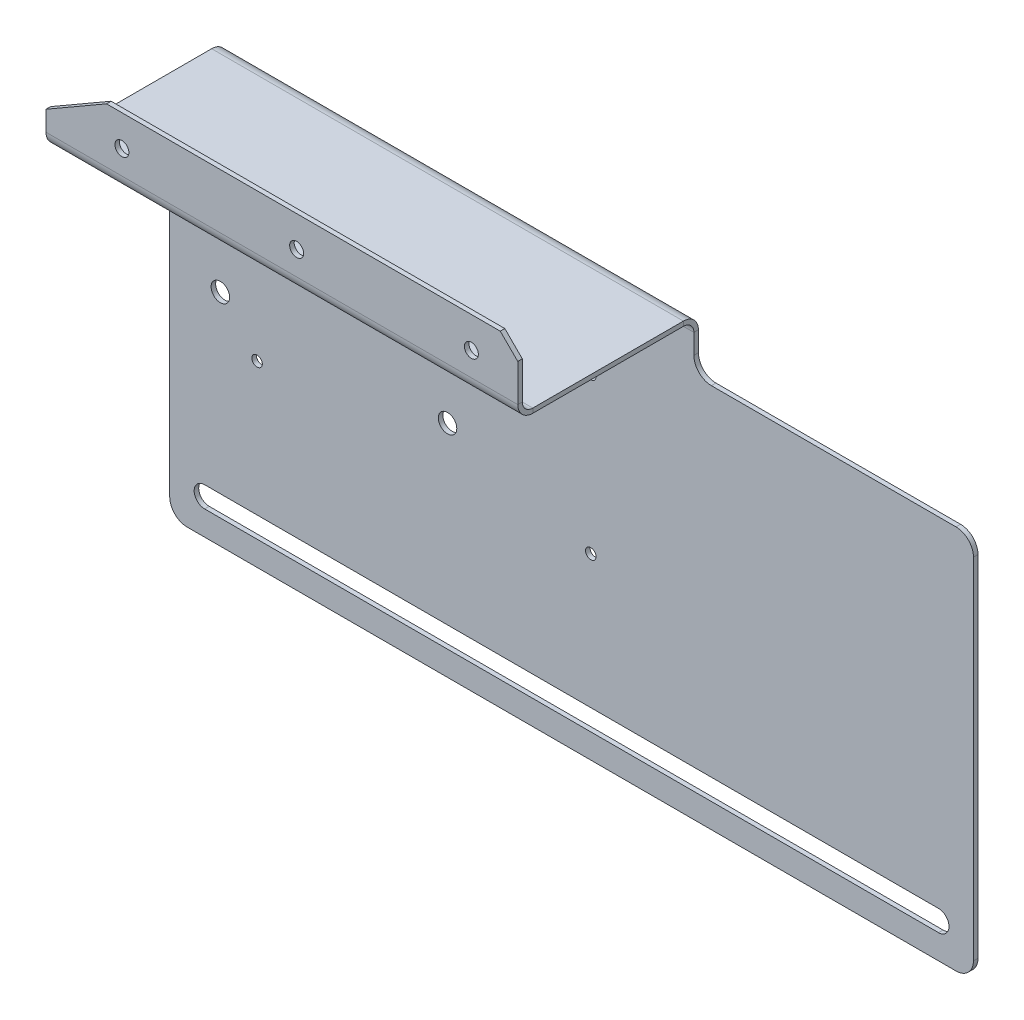
from build123d import *

# Parameters (mm, degrees)
SKETCH1_W                    = 230
SKETCH1_H                    = 125.055
BASE_FLANGE1_DEPTH           = 1.3
SKETCH12_W                   = 80
SKETCH12_H                   = 15
SKETCH12_W_2                 = 15
CUT_EXTRUDE1_DEPTH           = 131.905990147
EDGE_FLANGE1_STRIP_W         = 11.2
EDGE_FLANGE1_STRIP_H         = 1.3
EDGE_FLANGE1_STRIP_CUT_DEPTH = 135
EDGE_FLANGE1_DEPTH           = 135
EDGE_FLANGE2_DEPTH           = 135
CHAMFER1_SIZE                = 10
CHAMFER1_SIZE2               = 17.320508076
CHAMFER3_SIZE                = 5
FILLET1_R                    = 5
CUT_EXTRUDE3_DEPTH           = 150.542859262
CUT_EXTRUDE3_DEPTH_BACK      = 150.542859262
SKETCH14_R                   = 2
SKETCH15_R                   = 2.65
CUT_EXTRUDE4_DEPTH           = 1.3
SKETCH16_R                   = 1.5
CUT_EXTRUDE5_DEPTH           = 1.3


# Sheet-metal steps are written as plain solids
with BuildPart() as part:
    # Sketch1 → Base-Flange1 (new body)
    with BuildSketch(Plane.XY):
        Rectangle(SKETCH1_W, SKETCH1_H)
    extrude(amount=-BASE_FLANGE1_DEPTH)

    # Sketch12 → Cut-Extrude1 (cut, through all)
    with BuildSketch(Plane.XY):
        with Locations((75, 55.0275)):
            Rectangle(SKETCH12_W, SKETCH12_H)
        with Locations((-107.5, 55.0275)):
            Rectangle(SKETCH12_W_2, SKETCH12_H)
    extrude(amount=-CUT_EXTRUDE1_DEPTH, mode=Mode.SUBTRACT)

    # Edge-Flange1 strip (across the edge) → Edge-Flange1 strip cut (cut)
    with BuildSketch(Plane(origin=(35, 62.5275, 0), x_dir=(0, -1, 0), z_dir=(-1, 0, 0))):
        with Locations((-1.3, -0.65)):
            Rectangle(EDGE_FLANGE1_STRIP_W, EDGE_FLANGE1_STRIP_H)
    extrude(amount=EDGE_FLANGE1_STRIP_CUT_DEPTH, mode=Mode.SUBTRACT)

    # Edge-Flange1 section (across the edge) → Edge-Flange1 (add)
    with BuildSketch(Plane(origin=(35, 62.5275, 0), x_dir=(0, -1, 0), z_dir=(-1, 0, 0))):
        with BuildLine():
            Line((0, 3), (0, 40.4))
            Line((0, 40.4), (1.3, 40.4))
            Line((1.3, 40.4), (1.3, 3))
            ThreePointArc((1.3, 3), (2.178679656, 0.878679656), (4.3, 0))
            Line((4.3, 0), (4.3, -1.3))
            ThreePointArc((4.3, -1.3), (1.259440841, -0.040559159), (0, 3))
        make_face()
    extrude(amount=EDGE_FLANGE1_DEPTH)

    # Edge-Flange2 section (across the edge) → Edge-Flange2 (add)
    with BuildSketch(Plane(origin=(-100, 62.5275, 50.4), x_dir=(0, 0, -1), z_dir=(1, 0, 0))):
        with BuildLine():
            Line((0, 3), (0, 18.7))
            Line((0, 18.7), (1.3, 18.7))
            Line((1.3, 18.7), (1.3, 3))
            ThreePointArc((1.3, 3), (2.178679656, 0.878679656), (4.3, 0))
            Line((4.3, 0), (10, 0))
            Line((10, 0), (10, -1.3))
            Line((10, -1.3), (4.3, -1.3))
            ThreePointArc((4.3, -1.3), (1.259440841, -0.040559159), (0, 3))
        make_face()
    extrude(amount=EDGE_FLANGE2_DEPTH)

    # Chamfer1
    chamfer1_edges = [part.edges().sort_by_distance(p)[0] for p in [
        (-100, 81.2275, 49.75),
    ]]
    chamfer1_side = [part.faces().sort_by_distance(p)[0] for p in [
        (-100, 52.8775, -0.617136938),
    ]]
    chamfer(chamfer1_edges, length=CHAMFER1_SIZE, length2=CHAMFER1_SIZE2, reference=chamfer1_side[0])

    # Chamfer3
    chamfer3_edges = [part.edges().sort_by_distance(p)[0] for p in [
        (35, 81.2275, 49.75),
    ]]
    chamfer(chamfer3_edges, length=CHAMFER3_SIZE)

    # Fillet1
    fillet1_edges = [part.edges().sort_by_distance(p)[0] for p in [
        (115, 47.5275, -0.65),
        (35, 47.5275, -0.65),
        (-115, 47.5275, -0.65),
        (-100, 47.5275, -0.65),
        (115, -62.5275, -0.65),
        (-115, -62.5275, -0.65),
    ]]
    fillet(fillet1_edges, radius=FILLET1_R)

    # Sketch14 → Cut-Extrude3 (cut, two sides: drawn at the far end of the back side and taken through both)
    with BuildSketch(Plane(origin=(0, 0, 49.1), x_dir=(-1, 0, 0), z_dir=(0, 0, -1)).offset(-CUT_EXTRUDE3_DEPTH_BACK)):
        with Locations((-21.722047565, 72.3475)):
            Circle(SKETCH14_R)
        with Locations((28.277952435, 72.3475)):
            Circle(SKETCH14_R)
        with Locations((78.277952435, 72.3475)):
            Circle(SKETCH14_R)
        with BuildLine():
            Line((-105, -49.5275), (105, -49.5275))
            ThreePointArc((105, -49.5275), (108, -52.5275), (105, -55.5275))
            Line((105, -55.5275), (-105, -55.5275))
            ThreePointArc((-105, -55.5275), (-108, -52.5275), (-105, -49.5275))
        make_face()
    extrude(amount=CUT_EXTRUDE3_DEPTH + CUT_EXTRUDE3_DEPTH_BACK, mode=Mode.SUBTRACT)

    # Sketch15 → Cut-Extrude4 (cut)
    with BuildSketch(Plane(origin=(0, 0, -1.3), x_dir=(-1, 0, 0), z_dir=(0, 0, -1))):
        with Locations((35.5, 0.4725)):
            Circle(SKETCH15_R)
        with Locations((100.5, 0.4725)):
            Circle(SKETCH15_R)
    extrude(amount=-CUT_EXTRUDE4_DEPTH, mode=Mode.SUBTRACT)

    # Sketch16 → Cut-Extrude5 (cut)
    with BuildSketch(Plane(origin=(0, 0, -1.3), x_dir=(-1, 0, 0), z_dir=(0, 0, -1))):
        with Locations((90, 33.2275)):
            Circle(SKETCH16_R)
        with Locations((-5.5, 33.2275)):
            Circle(SKETCH16_R)
        with Locations((-5.5, -11.3725)):
            Circle(SKETCH16_R)
        with Locations((90, -11.3725)):
            Circle(SKETCH16_R)
    extrude(amount=-CUT_EXTRUDE5_DEPTH, mode=Mode.SUBTRACT)


solid = part.part
